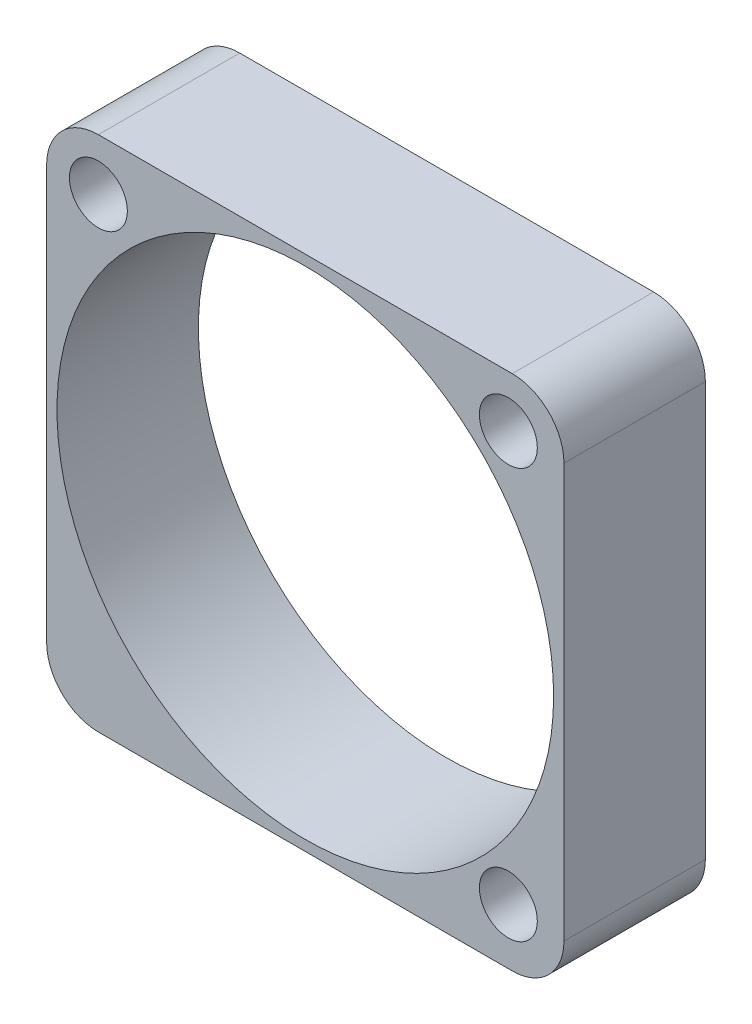
from build123d import *

# Parameters (mm, degrees)
SKETCH1_W           = 25
SKETCH1_H           = 25
BOSS_EXTRUDE1_DEPTH = 6.8325
SKETCH2_R           = 12
CUT_EXTRUDE1_DEPTH  = 37.009485643
SKETCH3_R           = 1.4
CUT_EXTRUDE2_DEPTH  = 37.009485643
FILLET1_R           = 2.5


with BuildPart() as part:
    # Sketch1 → Boss-Extrude1 (new body)
    with BuildSketch(Plane.XY):
        with Locations((12.5, 12.5)):
            Rectangle(SKETCH1_W, SKETCH1_H)
    extrude(amount=BOSS_EXTRUDE1_DEPTH)

    # Sketch2 → Cut-Extrude1 (cut, through all)
    with BuildSketch(Plane.XY.offset(6.8325)):
        with Locations((12.5, 12.5)):
            Circle(SKETCH2_R)
    extrude(amount=-CUT_EXTRUDE1_DEPTH, mode=Mode.SUBTRACT)

    # Sketch3 → Cut-Extrude2 (cut, through all)
    with BuildSketch(Plane.XY.offset(6.8325)):
        with Locations((2.5, 22.5)):
            Circle(SKETCH3_R)
        with Locations((22.312, 22.5)):
            Circle(SKETCH3_R)
        with Locations((22.312, 2.688)):
            Circle(SKETCH3_R)
    extrude(amount=-CUT_EXTRUDE2_DEPTH, mode=Mode.SUBTRACT)

    # Fillet1
    fillet1_edges = [part.edges().sort_by_distance(p)[0] for p in [
        (0, 25, 3.41625),
        (0, 0, 3.41625),
        (25, 0, 3.41625),
        (25, 25, 3.41625),
    ]]
    fillet(fillet1_edges, radius=FILLET1_R)


solid = part.part
